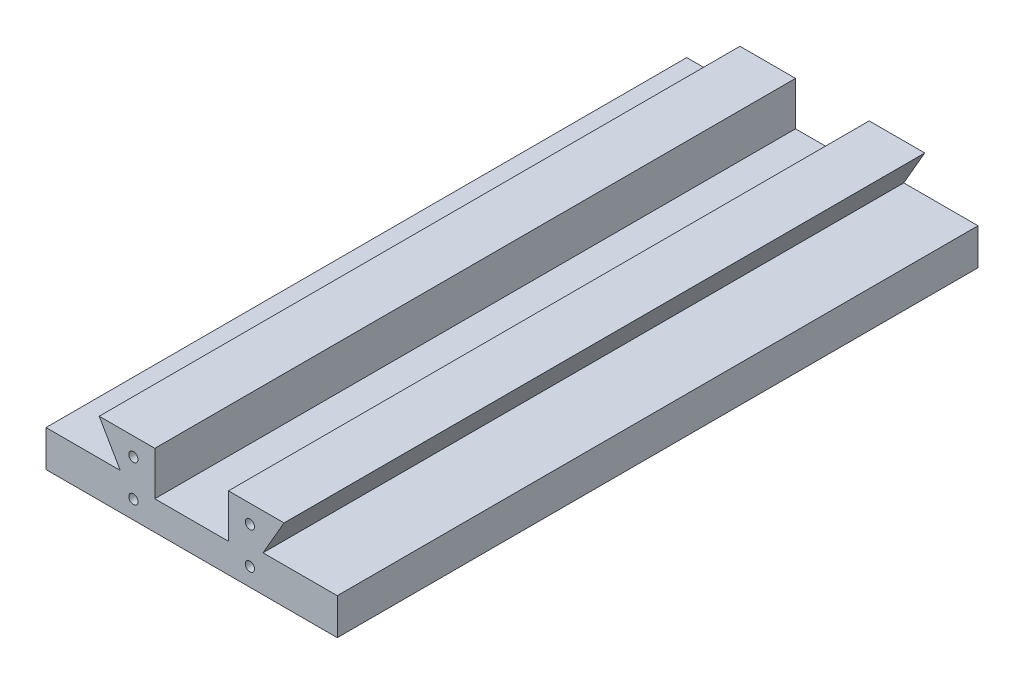
from build123d import *

# Parameters (mm, degrees)
X_GUIDE_EXTRUDE_DEPTH   = 279.4
END_PLATE_HOLES_D       = 4.0386
END_PLATE_HOLES_DEPTH   = 11.938
END_PLATE_HOLES_TIP     = 1.213317848
END_PLATE_HOLES_2_D     = 4.0386
END_PLATE_HOLES_2_DEPTH = 11.938
END_PLATE_HOLES_2_TIP   = 1.213317848


with BuildPart() as part:
    # dovetail-male-profile → x-guide-extrude (new body)
    with BuildSketch(Plane.XY):
        Polygon((-63.5, 15.875), (-63.5, 0), (63.5, 0), (63.5, 15.875), (38.459564477, 15.875), (31.127216058, 15.875), (40.146004613, 31.496), (40.292651581, 31.75), (16.056336319, 31.75), (16.056336319, 12.7), (-16.056336319, 12.7), (-16.056336319, 31.75), (-40.292651581, 31.75), (-31.127216058, 15.875), (-38.459564477, 15.875), align=None)
    extrude(amount=X_GUIDE_EXTRUDE_DEPTH)

    # end plate holes
    with Locations(Plane(origin=(0, 0, 0), x_dir=(-1, 0, 0), z_dir=(0, 0, -1))):
        with Locations((-25.4, 23.8125), (25.4, 23.8125), (25.4, 7.874), (-25.4, 7.874)):
            Hole(END_PLATE_HOLES_D / 2, depth=END_PLATE_HOLES_DEPTH)
            with Locations((0, 0, -(END_PLATE_HOLES_DEPTH + END_PLATE_HOLES_TIP / 2))):  # 118° drill point
                Cone(0, END_PLATE_HOLES_D / 2, END_PLATE_HOLES_TIP, mode=Mode.SUBTRACT)

    # end plate holes 2
    with Locations(Plane.XY.offset(279.4)):
        with Locations((25.4, 23.8125), (25.4, 7.874), (-25.4, 7.874), (-25.4, 23.8125)):
            Hole(END_PLATE_HOLES_2_D / 2, depth=END_PLATE_HOLES_2_DEPTH)
            with Locations((0, 0, -(END_PLATE_HOLES_2_DEPTH + END_PLATE_HOLES_2_TIP / 2))):  # 118° drill point
                Cone(0, END_PLATE_HOLES_2_D / 2, END_PLATE_HOLES_2_TIP, mode=Mode.SUBTRACT)


solid = part.part
